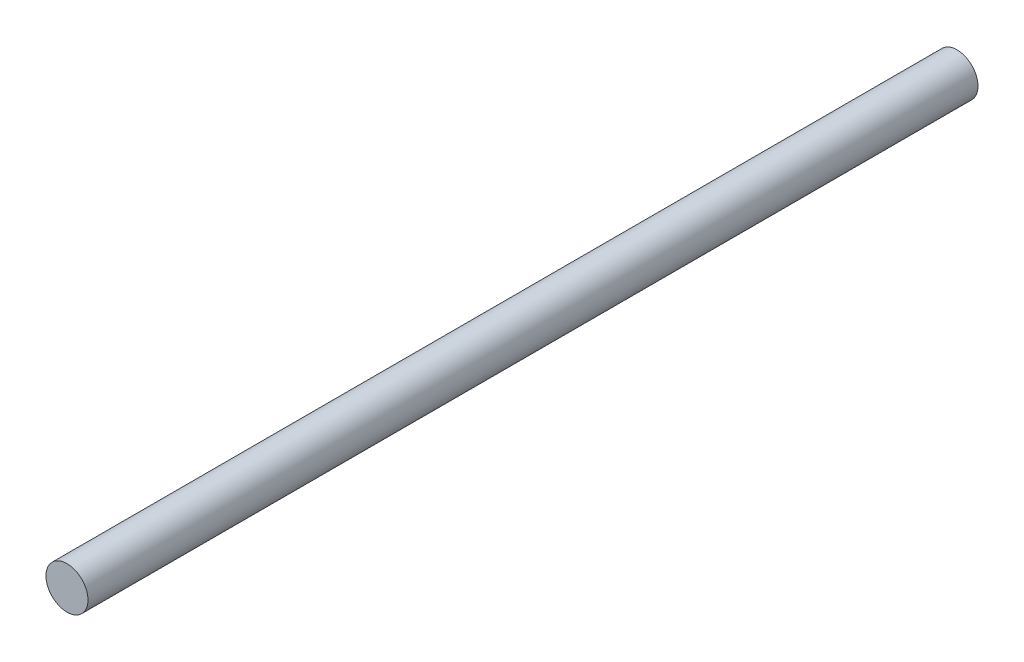
from build123d import *

# Parameters (mm, degrees)
SKETCH1_R           = 2.4892
BOSS_EXTRUDE1_DEPTH = 105.41


with BuildPart() as part:
    # Sketch1 → Boss-Extrude1 (new body)
    with BuildSketch(Plane.XY):
        Circle(SKETCH1_R)
    extrude(amount=BOSS_EXTRUDE1_DEPTH)


solid = part.part
